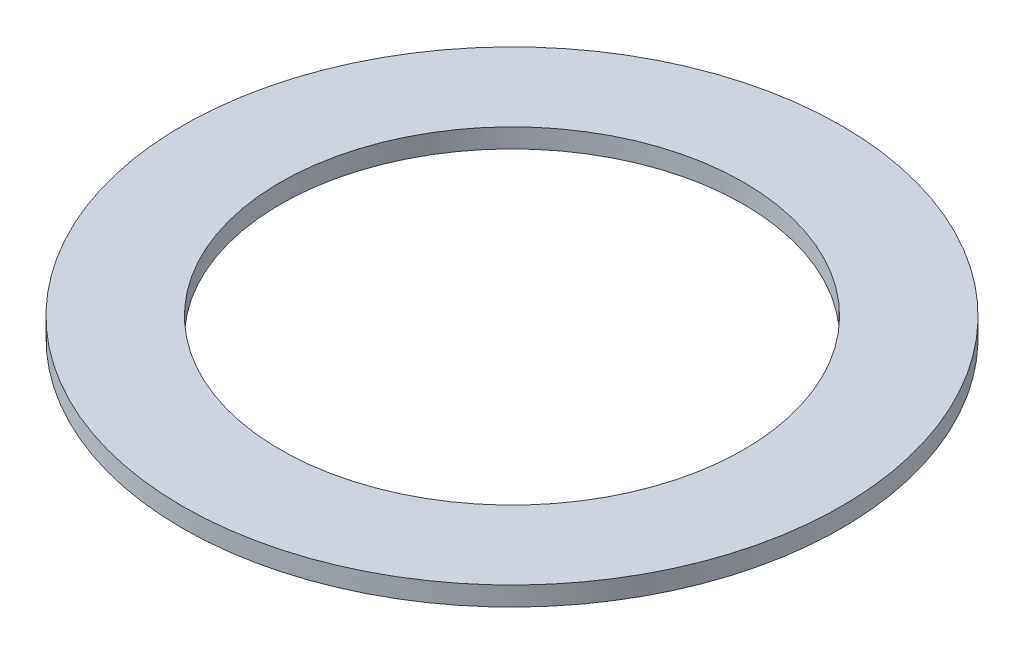
from build123d import *

# Parameters (mm, degrees)
SCHIZZO1_W = 20.5
SCHIZZO1_H = 4


with BuildPart() as part:
    # Schizzo1 → Rivoluzione1 (revolve)
    with BuildSketch(Plane.XY):
        with Locations((-58.75, 2)):
            Rectangle(SCHIZZO1_W, SCHIZZO1_H)
    revolve(axis=Axis((0, 0, 0), (0, 1, 0)))


solid = part.part
